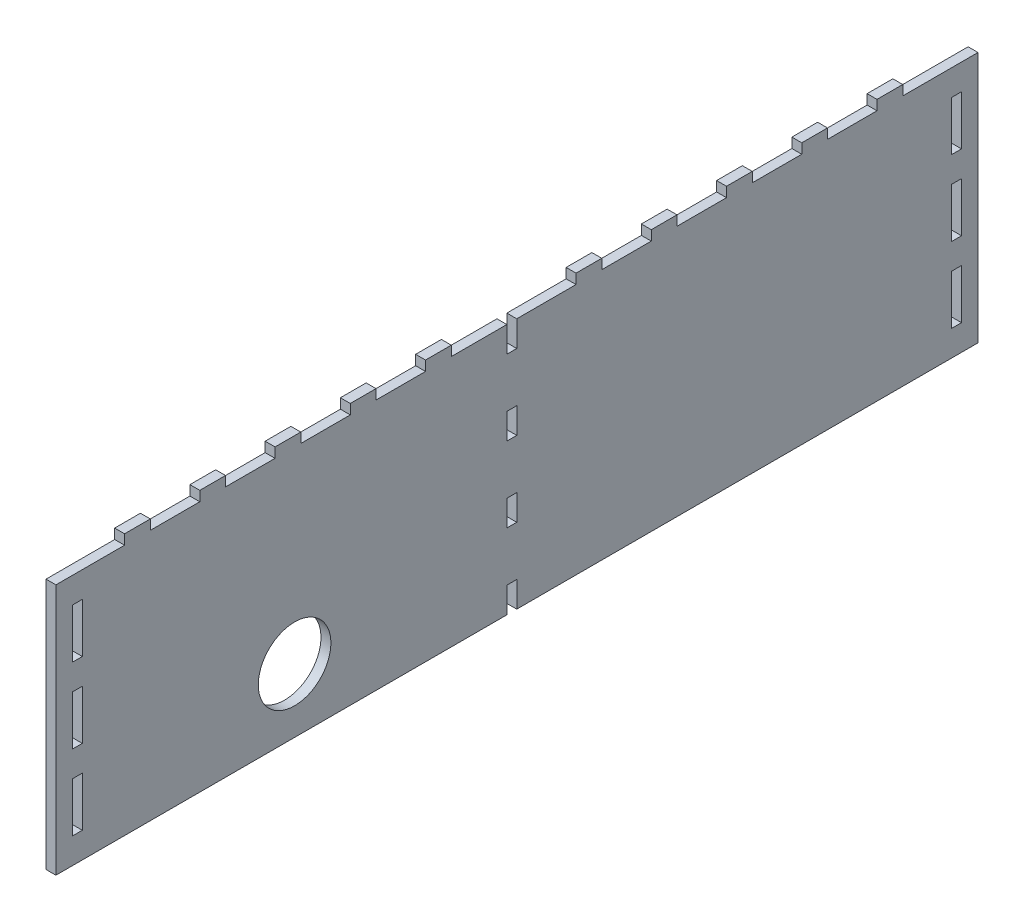
from build123d import *

# Parameters (mm, degrees)
SKETCH1_W               = 279.4
SKETCH1_H               = 76.2
BOSS_EXTRUDE1_DEPTH     = 3
SKETCH3_W               = 3
SKETCH3_H               = 15
CUT_EXTRUDE1_DEPTH      = 145.833352512
LPATTERN1_COUNT         = 3
LPATTERN1_PITCH         = 22.8
MIRROR1_COPY_1_SKETCH_W = 3
MIRROR1_COPY_1_SKETCH_H = 15
MIRROR1_COPY_1_DEPTH    = 145.833352512
MIRROR1_COPY_2_SKETCH_W = 3
MIRROR1_COPY_2_SKETCH_H = 15
MIRROR1_COPY_2_DEPTH    = 145.833352512
MIRROR1_COPY_3_SKETCH_W = 3
MIRROR1_COPY_3_SKETCH_H = 15
MIRROR1_COPY_3_DEPTH    = 145.833352512
SKETCH6_W               = 3
SKETCH6_H               = 7.8
CUT_EXTRUDE2_DEPTH      = 145.833352512
LPATTERN2_COUNT         = 4
LPATTERN2_PITCH         = 22.8
SKETCH8_W               = 3
SKETCH8_H               = 7.8
BOSS_EXTRUDE2_DEPTH     = 3
LPATTERN4_COUNT         = 11
LPATTERN4_PITCH         = 22.8
SKETCH9_R               = 11
CUT_EXTRUDE3_DEPTH      = 146.651295909


with BuildPart() as part:
    # Sketch1 → Boss-Extrude1 (new body)
    with BuildSketch(Plane(origin=(0, 0, 0), x_dir=(0, 0, -1), z_dir=(1, 0, 0))):
        Rectangle(SKETCH1_W, SKETCH1_H)
    extrude(amount=-BOSS_EXTRUDE1_DEPTH)

    # Sketch3 → Cut-Extrude1 (cut, through all)
    with BuildSketch(Plane.ZY.offset(3)):
        with Locations((133.2, 22.8)):
            Rectangle(SKETCH3_W, SKETCH3_H)
    cut_extrude1 = extrude(amount=-CUT_EXTRUDE1_DEPTH, mode=Mode.SUBTRACT)

    # LPattern1: Cut-Extrude1 ×3
    with Locations(*[(0, -i * LPATTERN1_PITCH, 0) for i in range(1, LPATTERN1_COUNT)]):
        add(cut_extrude1, mode=Mode.SUBTRACT)

    # Mirror1 copy 1 sketch → Mirror1 copy 1 (cut, through all)
    with BuildSketch(Plane(origin=(-3, -22.8, 0), x_dir=(0, 0, -1), z_dir=(-1, 0, 0))):
        with Locations((133.2, -22.8)):
            Rectangle(MIRROR1_COPY_1_SKETCH_W, MIRROR1_COPY_1_SKETCH_H)
    extrude(amount=-MIRROR1_COPY_1_DEPTH, mode=Mode.SUBTRACT)

    # Mirror1 copy 2 sketch → Mirror1 copy 2 (cut, through all)
    with BuildSketch(Plane(origin=(-3, -45.6, 0), x_dir=(0, 0, -1), z_dir=(-1, 0, 0))):
        with Locations((133.2, -22.8)):
            Rectangle(MIRROR1_COPY_2_SKETCH_W, MIRROR1_COPY_2_SKETCH_H)
    extrude(amount=-MIRROR1_COPY_2_DEPTH, mode=Mode.SUBTRACT)

    # Mirror1 copy 3 sketch → Mirror1 copy 3 (cut, through all)
    with BuildSketch(Plane(origin=(-3, 0, 0), x_dir=(0, 0, -1), z_dir=(-1, 0, 0))):
        with Locations((133.2, -22.8)):
            Rectangle(MIRROR1_COPY_3_SKETCH_W, MIRROR1_COPY_3_SKETCH_H)
    extrude(amount=-MIRROR1_COPY_3_DEPTH, mode=Mode.SUBTRACT)

    # Sketch6 → Cut-Extrude2 (cut, through all)
    with BuildSketch(Plane.ZY.offset(3)):
        with Locations((1.56, 34.2)):
            Rectangle(SKETCH6_W, SKETCH6_H)
    cut_extrude2 = extrude(amount=-CUT_EXTRUDE2_DEPTH, mode=Mode.SUBTRACT)

    # LPattern2: Cut-Extrude2 ×4
    with Locations(*[(0, -i * LPATTERN2_PITCH, 0) for i in range(1, LPATTERN2_COUNT)]):
        add(cut_extrude2, mode=Mode.SUBTRACT)

    # Sketch8 → Boss-Extrude2 (add)
    with BuildSketch(Plane(origin=(0, 38.1, 0), x_dir=(1, 0, 0), z_dir=(0, 1, 0))):
        with Locations((-1.5, 113)):
            Rectangle(SKETCH8_W, SKETCH8_H)
    boss_extrude2 = extrude(amount=BOSS_EXTRUDE2_DEPTH)

    # LPattern4: Boss-Extrude2 ×11, 1 skipped
    with Locations(*[(0, 0, i * LPATTERN4_PITCH) for i in range(1, LPATTERN4_COUNT) if i not in (5,)]):
        add(boss_extrude2)

    # Sketch9 → Cut-Extrude3 (cut, through all)
    with BuildSketch(Plane.ZY.offset(3)):
        with Locations((67.38, -18.8)):
            Circle(SKETCH9_R)
    extrude(amount=-CUT_EXTRUDE3_DEPTH, mode=Mode.SUBTRACT)


solid = part.part
